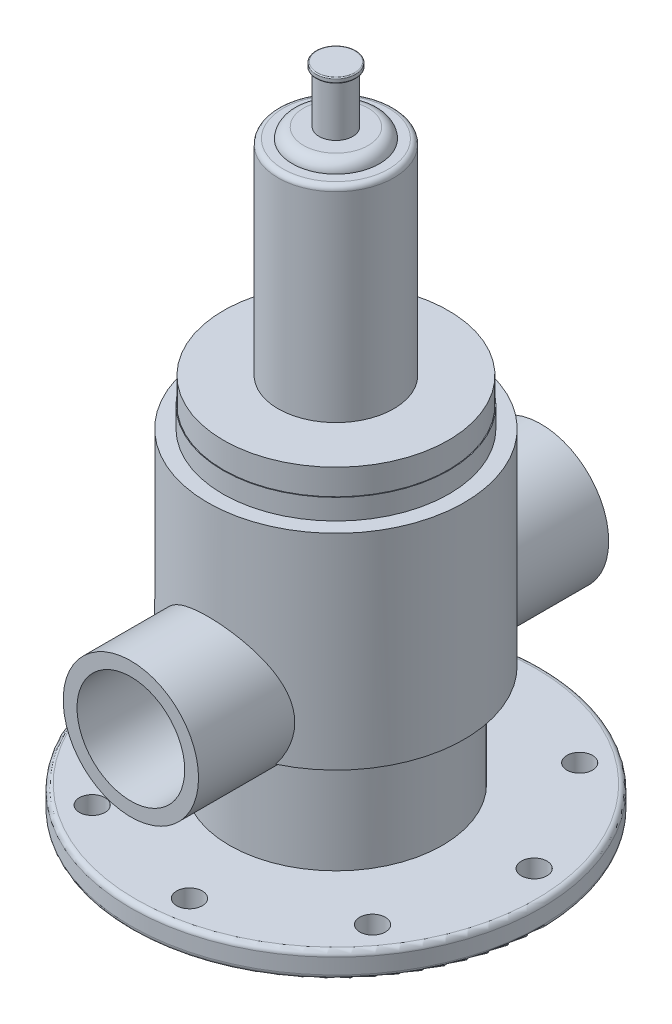
from build123d import *

# Parameters (mm, degrees)
SKETCH1_R                = 50.8
SKETCH1_R_2              = 3.175
BOSS_EXTRUDE1_DEPTH      = 6.35
FILLET1_R                = 1.27
FILLET2_R                = 1.27
SKETCH2_R                = 26.391587244
BOSS_EXTRUDE2_DEPTH      = 25.4
SKETCH3_R                = 31.75
BOSS_EXTRUDE3_DEPTH      = 50.8
BOSS_EXTRUDE4_DEPTH      = 50.8
BOSS_EXTRUDE4_DEPTH_BACK = 50.8
SKETCH4_R                = 16.764
SKETCH4_R_2              = 13.335
SKETCH5_R                = 24.315881968
BOSS_EXTRUDE5_DEPTH      = 5.08
FILLET3_R                = 2.54
SKETCH6_R                = 28.027502095
BOSS_EXTRUDE6_DEPTH      = 5.08
SKETCH7_R                = 27.855051321
BOSS_EXTRUDE7_DEPTH      = 6.35
SKETCH8_R                = 14.329930432
BOSS_EXTRUDE8_DEPTH      = 50.8
SKETCH9_R                = 10.798471599
BOSS_EXTRUDE9_DEPTH      = 2.54
SKETCH10_R               = 4.167310688
BOSS_EXTRUDE10_DEPTH     = 12.7
SKETCH11_R               = 4.921606902
BOSS_EXTRUDE11_DEPTH     = 1.27
FILLET7_R                = 0.254
FILLET8_R                = 2.794
FILLET9_R                = 1.27


with BuildPart() as part:
    # Sketch1 → Boss-Extrude1 (new body)
    with BuildSketch(Plane(origin=(0, 0, 0), x_dir=(1, 0, 0), z_dir=(0, 1, 0))):
        with Locations(Location((0, 0, 0), (0, 0, 270))):
            Circle(SKETCH1_R)
        with Locations(Location((-6.413018611, 42.692757586, 0), (0, 0, 270))):
            Circle(SKETCH1_R_2, mode=Mode.SUBTRACT)
        with Locations(Location((25.653649449, 34.723027344, 0), (0, 0, 270))):
            Circle(SKETCH1_R_2, mode=Mode.SUBTRACT)
        with Locations(Location((42.692757586, 6.413018611, 0), (0, 0, 270))):
            Circle(SKETCH1_R_2, mode=Mode.SUBTRACT)
        with Locations(Location((34.723027344, -25.653649449, 0), (0, 0, 270))):
            Circle(SKETCH1_R_2, mode=Mode.SUBTRACT)
        with Locations(Location((6.413018611, -42.692757586, 0), (0, 0, 270))):
            Circle(SKETCH1_R_2, mode=Mode.SUBTRACT)
        with Locations(Location((-25.653649449, -34.723027344, 0), (0, 0, 270))):
            Circle(SKETCH1_R_2, mode=Mode.SUBTRACT)
        with Locations(Location((-42.692757586, -6.413018611, 0), (0, 0, 270))):
            Circle(SKETCH1_R_2, mode=Mode.SUBTRACT)
        with Locations(Location((-34.723027344, 25.653649449, 0), (0, 0, 270))):
            Circle(SKETCH1_R_2, mode=Mode.SUBTRACT)
    extrude(amount=BOSS_EXTRUDE1_DEPTH)

    # Fillet1
    fillet1_edges = [part.edges().sort_by_distance(p)[0] for p in [
        (0, 6.35, -50.8),
    ]]
    fillet(fillet1_edges, radius=FILLET1_R)

    # Fillet2
    fillet2_edges = [part.edges().sort_by_distance(p)[0] for p in [
        (0, 0, -50.8),
    ]]
    fillet(fillet2_edges, radius=FILLET2_R)

    # Sketch2 → Boss-Extrude2 (add)
    with BuildSketch(Plane(origin=(0, 6.35, 0), x_dir=(1, 0, 0), z_dir=(0, 1, 0))):
        with Locations(Location((0, 0, 0), (0, 0, 270))):
            Circle(SKETCH2_R)
    extrude(amount=BOSS_EXTRUDE2_DEPTH)

    # Sketch3 → Boss-Extrude3 (add)
    with BuildSketch(Plane(origin=(0, 31.75, 0), x_dir=(1, 0, 0), z_dir=(0, 1, 0))):
        with Locations(Location((0, 0, 0), (0, 0, 270))):
            Circle(SKETCH3_R)
    extrude(amount=BOSS_EXTRUDE3_DEPTH)

    # Sketch4 → Boss-Extrude4 (add, two sides: drawn at the far end of the back side and taken through both)
    with BuildSketch(Plane.XY.offset(-BOSS_EXTRUDE4_DEPTH_BACK)):
        with Locations((0, 41.393564688)):
            Circle(SKETCH4_R)
        with Locations((0, 41.393564688)):
            Circle(SKETCH4_R_2, mode=Mode.SUBTRACT)
    extrude(amount=BOSS_EXTRUDE4_DEPTH + BOSS_EXTRUDE4_DEPTH_BACK)

    # Sketch5 → Boss-Extrude5 (add)
    with BuildSketch(Plane.XZ):
        with Locations(Location((0, 0, 0), (0, 0, 90))):
            Circle(SKETCH5_R)
    extrude(amount=BOSS_EXTRUDE5_DEPTH)

    # Fillet3
    fillet3_edges = [part.edges().sort_by_distance(p)[0] for p in [
        (0, -5.08, -24.315881968),
    ]]
    fillet(fillet3_edges, radius=FILLET3_R)

    # Sketch6 → Boss-Extrude6 (add)
    with BuildSketch(Plane(origin=(0, 82.55, 0), x_dir=(1, 0, 0), z_dir=(0, 1, 0))):
        with Locations(Location((0, 0, 0), (0, 0, 270))):
            Circle(SKETCH6_R)
    extrude(amount=BOSS_EXTRUDE6_DEPTH)

    # Sketch7 → Boss-Extrude7 (add)
    with BuildSketch(Plane(origin=(0, 87.63, 0), x_dir=(1, 0, 0), z_dir=(0, 1, 0))):
        with Locations(Location((0, 0, 0), (0, 0, 270))):
            Circle(SKETCH7_R)
    extrude(amount=BOSS_EXTRUDE7_DEPTH)

    # Sketch8 → Boss-Extrude8 (add)
    with BuildSketch(Plane(origin=(0, 93.98, 0), x_dir=(1, 0, 0), z_dir=(0, 1, 0))):
        with Locations(Location((0, 0, 0), (0, 0, 270))):
            Circle(SKETCH8_R)
    extrude(amount=BOSS_EXTRUDE8_DEPTH)

    # Sketch9 → Boss-Extrude9 (add)
    with BuildSketch(Plane(origin=(0, 144.78, 0), x_dir=(1, 0, 0), z_dir=(0, 1, 0))):
        with Locations(Location((0, 0, 0), (0, 0, 270))):
            Circle(SKETCH9_R)
    extrude(amount=BOSS_EXTRUDE9_DEPTH)

    # Sketch10 → Boss-Extrude10 (add)
    with BuildSketch(Plane(origin=(0, 147.32, 0), x_dir=(1, 0, 0), z_dir=(0, 1, 0))):
        with Locations(Location((0, 0, 0), (0, 0, 270))):
            Circle(SKETCH10_R)
    extrude(amount=BOSS_EXTRUDE10_DEPTH)

    # Sketch11 → Boss-Extrude11 (add)
    with BuildSketch(Plane(origin=(0, 160.02, 0), x_dir=(1, 0, 0), z_dir=(0, 1, 0))):
        with Locations(Location((0, 0, 0), (0, 0, 270))):
            Circle(SKETCH11_R)
    extrude(amount=BOSS_EXTRUDE11_DEPTH)

    # Fillet7
    fillet7_edges = [part.edges().sort_by_distance(p)[0] for p in [
        (0, 160.02, -4.921606902),
        (0, 161.29, -4.921606902),
    ]]
    fillet(fillet7_edges, radius=FILLET7_R)

    # Fillet8
    # the kernel refuses this fillet: 2.794 mm, written as the material it takes off along each edge
    with BuildSketch(Plane(origin=(0, 147.32, 0), x_dir=(0, 0, 1), z_dir=(-1, 0, 0))) as fillet8_piece_1:
        with BuildLine():
            CenterArc((8.016041007, -2.794), FILLET8_R, 5.21590857, 84.78409143)
            Line((10.798471599, -2.54), (10.854120211, -2.53492))
            ThreePointArc((10.854120211, -2.53492), (10.854351599, -1.27), (10.854351599, 0))
            Line((10.854351599, 0), (10.798471599, 0.05588))
            Line((10.798471599, 0.05588), (8.016041007, 0.05588))
            Line((8.016041007, 0.05588), (8.016041007, 0))
        make_face()
    revolve(axis=Axis((0, 147.32, 0), (0, 1, 0)), mode=Mode.SUBTRACT)

    # Fillet9
    fillet9_edges = [part.edges().sort_by_distance(p)[0] for p in [
        (0, 144.78, -14.329930432),
    ]]
    fillet(fillet9_edges, radius=FILLET9_R)


solid = part.part
